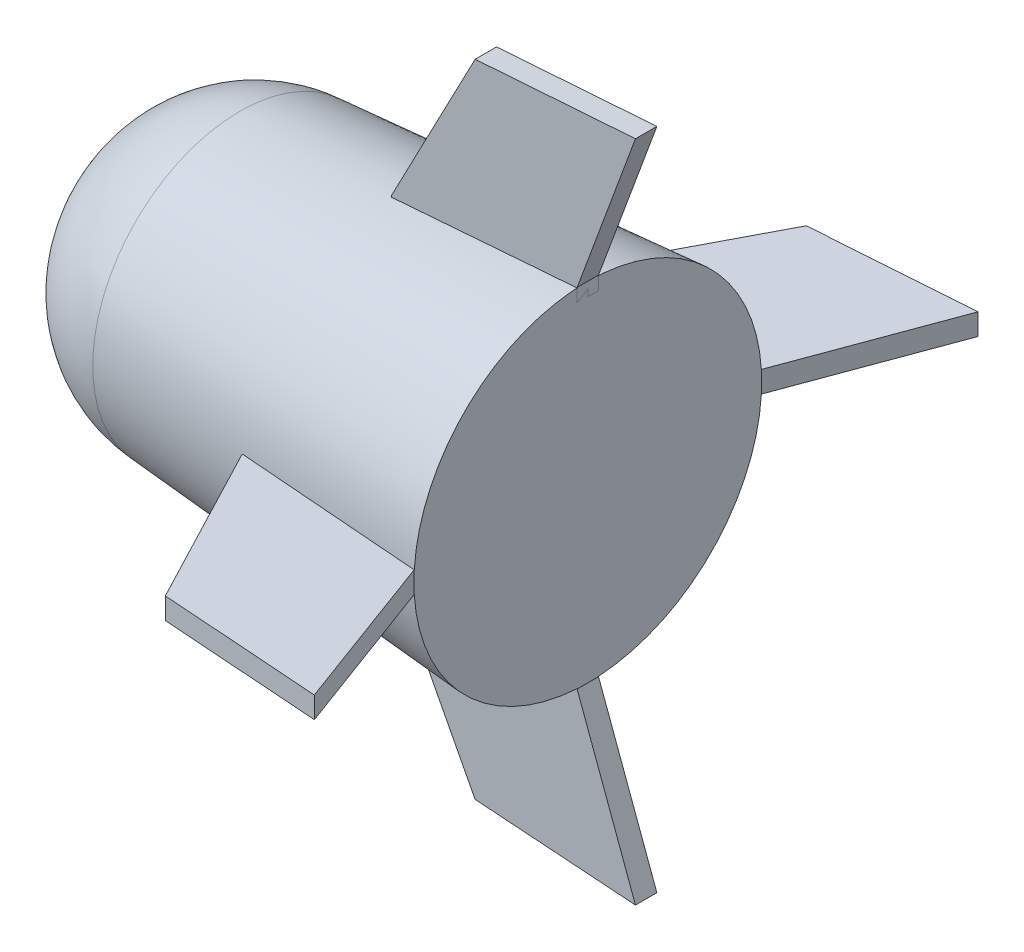
from build123d import *

# Parameters (mm, degrees)
BOSS_EXTRUDE1_DEPTH = 3.9999999999999964
SKETCH7_W           = 69.63811876509494
SKETCH7_H           = 7.9999999999999964
BOSS_EXTRUDE3_DEPTH = 5
CUT_EXTRUDE1_DEPTH  = 8
CIRPATTERN9_COUNT   = 4


with BuildPart() as part:
    # Sketch1 → Revolve2 (revolve)
    with BuildSketch(Plane.XY):
        with BuildLine():
            Line((130, 0), (130, 65))
            Line((130, 65), (-0.08823529411652789, 54.993212669683345))
            ThreePointArc((-0.08823529411652789, 54.993212669683345), (-35.07355292513978, 37.2641094699161), (-47.30768645318519, -7.610859269115e-05))
            Line((-47.30768645318519, -7.610859269115e-05), (130, 0))
        make_face()
    revolve(axis=Axis((-47.30768645318519, -7.610859269115e-05, 0), (0.9999999999999079, 4.2924587316883576e-07, 0)))


with BuildPart() as body_2:
    # Sketch4 → Boss-Extrude1 (new, symmetric)
    with BuildSketch(Plane.XY):
        Polygon((60.5670013233702, 60), (85.21256709805193, 107.07960057983084), (91.87886875280635, 119.81401382559683), (151.81086846261428, 124.04316356095536), (129.99999999999997, 64.99999999999997), (60.56700132337019, 59.65900010179771), align=None)
    boss_extrude1 = extrude(amount=BOSS_EXTRUDE1_DEPTH, both=True)

    # Sketch7 → Boss-Extrude3 (add)
    with BuildSketch(Plane(origin=(-4.205882352941161, 54.676470588235325, 0), x_dir=(0.9970544855015816, 0.07669649888473674, 0), z_dir=(0.07669649888473674, -0.9970544855015816, 0))):
        with Locations((99.783296160166, -1.78e-15)):
            Rectangle(SKETCH7_W, SKETCH7_H)
    boss_extrude3 = extrude(amount=BOSS_EXTRUDE3_DEPTH)

    # Sketch8 → Cut-Extrude1 (cut)
    with BuildSketch(Plane.XY.offset(3.9999999999999964)):
        Polygon((130.38348249442367, 60.01472757249208), (130.0000021525697, 59.98522908465717), (129.99999999999997, 65), align=None)
    cut_extrude1 = extrude(amount=-CUT_EXTRUDE1_DEPTH, mode=Mode.SUBTRACT)


with BuildPart() as part_1:
    add(part.part)

    # CirPattern9: Boss-Extrude1, Boss-Extrude3, Cut-Extrude1 ×4 about axis
    cirpattern9_axis = Axis((130.00002790098173, 1.197638e-11, 0), (-0.9999999999999079, -4.2924587316883587e-07, 0))
    add([boss_extrude1.rotate(cirpattern9_axis, i * 360 / CIRPATTERN9_COUNT) for i in range(1, CIRPATTERN9_COUNT)])
    add([boss_extrude3.rotate(cirpattern9_axis, i * 360 / CIRPATTERN9_COUNT) for i in range(1, CIRPATTERN9_COUNT)])
    add([cut_extrude1.rotate(cirpattern9_axis, i * 360 / CIRPATTERN9_COUNT) for i in range(1, CIRPATTERN9_COUNT)], mode=Mode.SUBTRACT)


solid = Compound([body_2.part, part_1.part])
